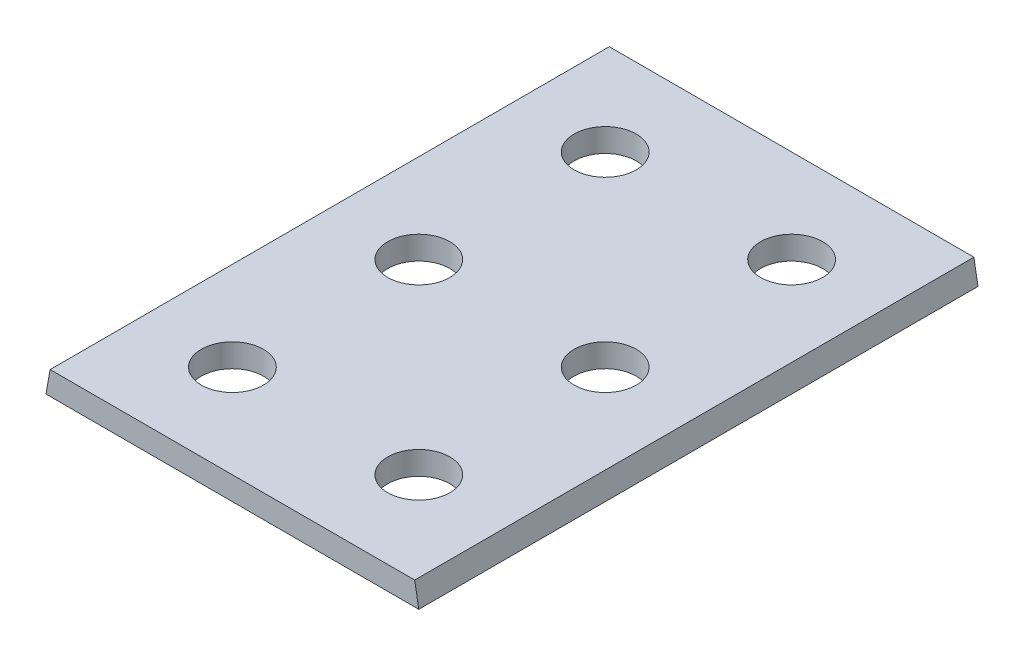
from build123d import *
from OCP.BRepFilletAPI import BRepFilletAPI_MakeChamfer

# Parameters (mm, degrees)
SKETCH1_R           = 9
BOSS_EXTRUDE1_DEPTH = 6.75
CHAMFER1_SIZE       = 6.75
CHAMFER1_SIZE_2     = 1.19020712


with BuildPart() as part:
    # Sketch1 → Boss-Extrude1 (new body)
    with BuildSketch(Plane(origin=(0, 0, 0), x_dir=(1, 0, 0), z_dir=(0, 1, 0))):
        Polygon((-45.420560748, -63.588785047), (-18.420560748, -63.588785047), (62.579439252, -63.588785047), (62.579439252, 98.411214953), (-45.420560748, 98.411214953), (-45.420560748, -36.588785047), align=None)
        with Locations(Location((-18.420560748, -36.588785047, 0), (0, 0, 270))):
            Circle(SKETCH1_R, mode=Mode.SUBTRACT)
        with Locations(Location((35.579439252, 71.411214953, 0), (0, 0, 90))):
            Circle(SKETCH1_R, mode=Mode.SUBTRACT)
        with Locations(Location((35.579439252, 17.411214953, 0), (0, 0, 90))):
            Circle(SKETCH1_R, mode=Mode.SUBTRACT)
        with Locations(Location((-18.420560748, 17.411214953, 0), (0, 0, 270))):
            Circle(SKETCH1_R, mode=Mode.SUBTRACT)
        with Locations(Location((-18.420560748, 71.411214953, 0), (0, 0, 270))):
            Circle(SKETCH1_R, mode=Mode.SUBTRACT)
        with Locations(Location((35.579439252, -36.588785047, 0), (0, 0, 90))):
            Circle(SKETCH1_R, mode=Mode.SUBTRACT)
    extrude(amount=BOSS_EXTRUDE1_DEPTH)

    # Chamfer1
    chamfer1_edges_1 = [part.edges().sort_by_distance(p)[0] for p in [
        (62.579439252, 6.75, -17.411214953),
    ]]
    chamfer1_side_1 = [part.faces().sort_by_distance(p)[0] for p in [
        (62.579439252, 6.726195858, -17.411214953),
    ]]
    chamfer1_edges_2 = [part.edges().sort_by_distance(p)[0] for p in [
        (-45.420560748, 6.75, -17.411214953),
    ]]
    chamfer1_side_2 = [part.faces().sort_by_distance(p)[0] for p in [
        (-45.396756605, 6.75, -17.411214953),
    ]]
    chamfer1 = BRepFilletAPI_MakeChamfer(part.part.solid().wrapped)
    for e in chamfer1_edges_1:
        chamfer1.Add(CHAMFER1_SIZE - 0.0001, CHAMFER1_SIZE_2 - 0.0001, e.wrapped, chamfer1_side_1[0].wrapped)
    for e in chamfer1_edges_2:
        chamfer1.Add(CHAMFER1_SIZE_2 - 0.0001, CHAMFER1_SIZE - 0.0001, e.wrapped, chamfer1_side_2[0].wrapped)
    add(Compound.cast(chamfer1.Shape()), mode=Mode.REPLACE)  # a hair under: the kernel refuses the full size


solid = part.part
